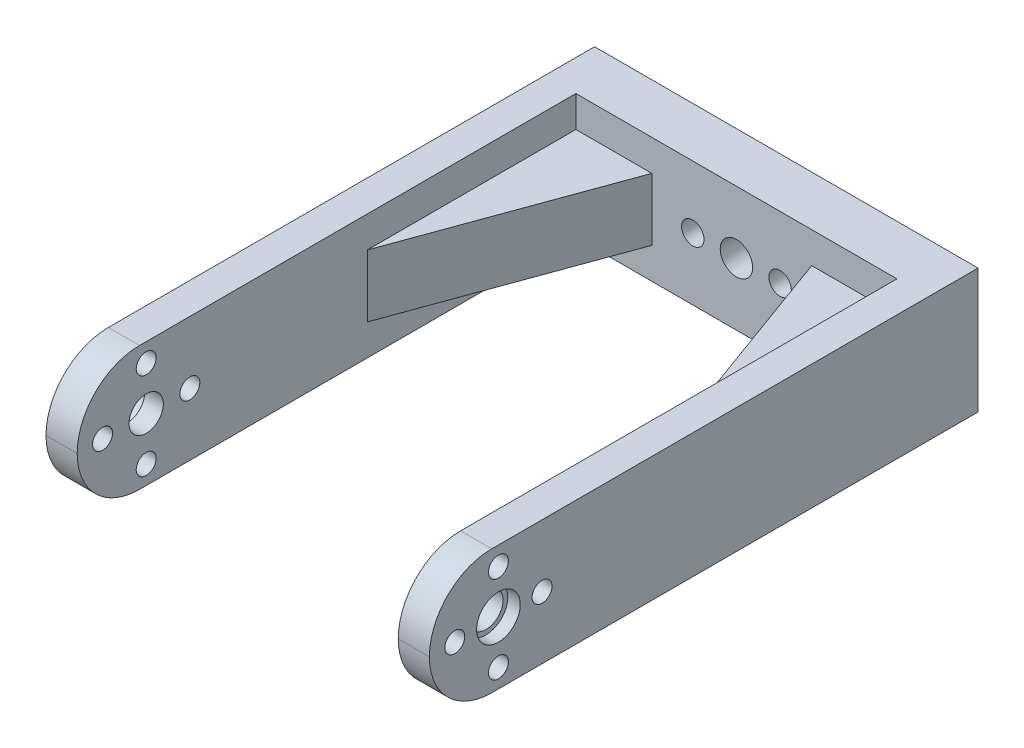
from build123d import *

# Parameters (mm, degrees)
ESQUISSE1_W                                 = 5
ESQUISSE1_H                                 = 20
BOSS_EXTRU_1_DEPTH                          = 80
BOSS_EXTRU_1_2_DEPTH                        = 80
ESQUISSE1_3_W                               = 61.5
ESQUISSE1_3_H                               = 20
BOSS_EXTRU_2_DEPTH                          = 8
ESQUISSE3_R                                 = 2.75
ENL_V_MAT_EXTRU_2_DEPTH                     = 85
ESQUISSE4_R                                 = 2.6
ESQUISSE4_R_2                               = 1.8
ENL_V_MAT_EXTRU_3_DEPTH                     = 10
CONG_4_R                                    = 10
ESQUISSE6_R                                 = 1.6
TROUS_PALONNIER_GRABCAD_M3_ENTRAXE_14_DEPTH = 103.870063673
NERVURE2_REACH                              = 103.401
ESQUISSE9_WALL_W                            = 40
ESQUISSE9_WALL_H                            = 10
ESQUISSE10_R                                = 3.5
ENL_V_MAT_EXTRU_4_DEPTH                     = 2
ENL_V_START                                 = -2
ESQUISSE11_R                                = 3.5
ENL_V_MAT_EXTRU_5_DEPTH                     = 2


with BuildPart() as part:
    # Esquisse1 → Boss.-Extru.1 (new body)
    with BuildSketch(Plane.XY):
        with Locations((2.5, 10)):
            Rectangle(ESQUISSE1_W, ESQUISSE1_H)
    extrude(amount=BOSS_EXTRU_1_DEPTH)



with BuildPart() as body_2:
    # Esquisse1 → Boss.-Extru.1 2 (new body)
    with BuildSketch(Plane.XY):
        with Locations((59, 10)):
            Rectangle(ESQUISSE1_W, ESQUISSE1_H)
    extrude(amount=BOSS_EXTRU_1_2_DEPTH)


with BuildPart() as part_1:
    add(part.part)

    add(body_2.part)  # Boss.-Extru.2 merges body 2
    # Esquisse1<3> → Boss.-Extru.2 (add)
    with BuildSketch(Plane.XY):
        with Locations((30.75, 10)):
            Rectangle(ESQUISSE1_3_W, ESQUISSE1_3_H)
    extrude(amount=-BOSS_EXTRU_2_DEPTH)

    # Esquisse3 → Enlèv. mat.-Extru.2 (cut)
    with BuildSketch(Plane(origin=(61.5, 0, 0), x_dir=(0, 0, -1), z_dir=(1, 0, 0))):
        with Locations((-68.927874881, 10)):
            Circle(ESQUISSE3_R)
    extrude(amount=-ENL_V_MAT_EXTRU_2_DEPTH, mode=Mode.SUBTRACT)

    # Esquisse4 → Enlèv. mat.-Extru.3 (cut)
    with BuildSketch(Plane(origin=(0, 0, -8), x_dir=(-1, 0, 0), z_dir=(0, 0, -1))):
        with Locations((-30.75, 10)):
            Circle(ESQUISSE4_R)
        with Locations((-37.75, 10)):
            Circle(ESQUISSE4_R_2)
        with Locations((-23.75, 10)):
            Circle(ESQUISSE4_R_2)
    extrude(amount=-ENL_V_MAT_EXTRU_3_DEPTH, mode=Mode.SUBTRACT)

    # Congé4
    cong_4_edges = [part_1.edges().sort_by_distance(p)[0] for p in [
        (2.5, 20, 80),
        (2.5, 0, 80),
        (59, 0, 80),
        (59, 20, 80),
    ]]
    fillet(cong_4_edges, radius=CONG_4_R - 0.0001)  # a hair under: the kernel refuses the full size

    # Esquisse6 → Trous palonnier GrabCAD M3 entraxe 14 (cut, through all)
    with BuildSketch(Plane(origin=(0, 0, 0), x_dir=(0, 0, -1), z_dir=(1, 0, 0))):
        with Locations((-75.927874881, 10)):
            Circle(ESQUISSE6_R)
        with Locations((-68.927874881, 17)):
            Circle(ESQUISSE6_R)
        with Locations((-61.927874881, 10)):
            Circle(ESQUISSE6_R)
        with Locations((-68.927874881, 3)):
            Circle(ESQUISSE6_R)
    extrude(amount=TROUS_PALONNIER_GRABCAD_M3_ENTRAXE_14_DEPTH, mode=Mode.SUBTRACT)

    # Esquisse9 wall → Nervure2 (add, up to next)
    with BuildSketch(Plane(origin=(49.659597134, 10, 18.793852416), x_dir=(0.342020143329, 0, 0.939692620785), z_dir=(-0.939692620785, 0, 0.342020143329)), mode=Mode.PRIVATE) as nervure2_sk1:
        Rectangle(ESQUISSE9_WALL_W, ESQUISSE9_WALL_H)
    nervure2_tool1 = extrude(nervure2_sk1.sketch, amount=-NERVURE2_REACH, mode=Mode.PRIVATE) - part_1.part
    nervure2 = nervure2_tool1.solids().sort_by_distance((49.659597134, 10, 18.793852416))[0]
    add(nervure2)

    # Symétrie1: Nervure2 across plane
    add(nervure2.mirror(Plane.ZY.offset(-30)))

    # Esquisse10 → Enlèv. mat.-Extru.4 (cut)
    with BuildSketch(Plane(origin=(61.5, 0, 0), x_dir=(0, 0, -1), z_dir=(1, 0, 0))):
        with Locations((-68.927874881, 10)):
            Circle(ESQUISSE10_R)
    extrude(amount=-ENL_V_MAT_EXTRU_4_DEPTH, mode=Mode.SUBTRACT)

    # Esquisse11 → Enlèv. mat.-Extru.5 (cut)
    with BuildSketch(Plane.ZY.offset(ENL_V_START)):
        with Locations(Location((68.927874881, 10, 0), (0, 0, 180))):
            Circle(ESQUISSE11_R)
    extrude(amount=ENL_V_MAT_EXTRU_5_DEPTH, mode=Mode.SUBTRACT)


solid = part_1.part
